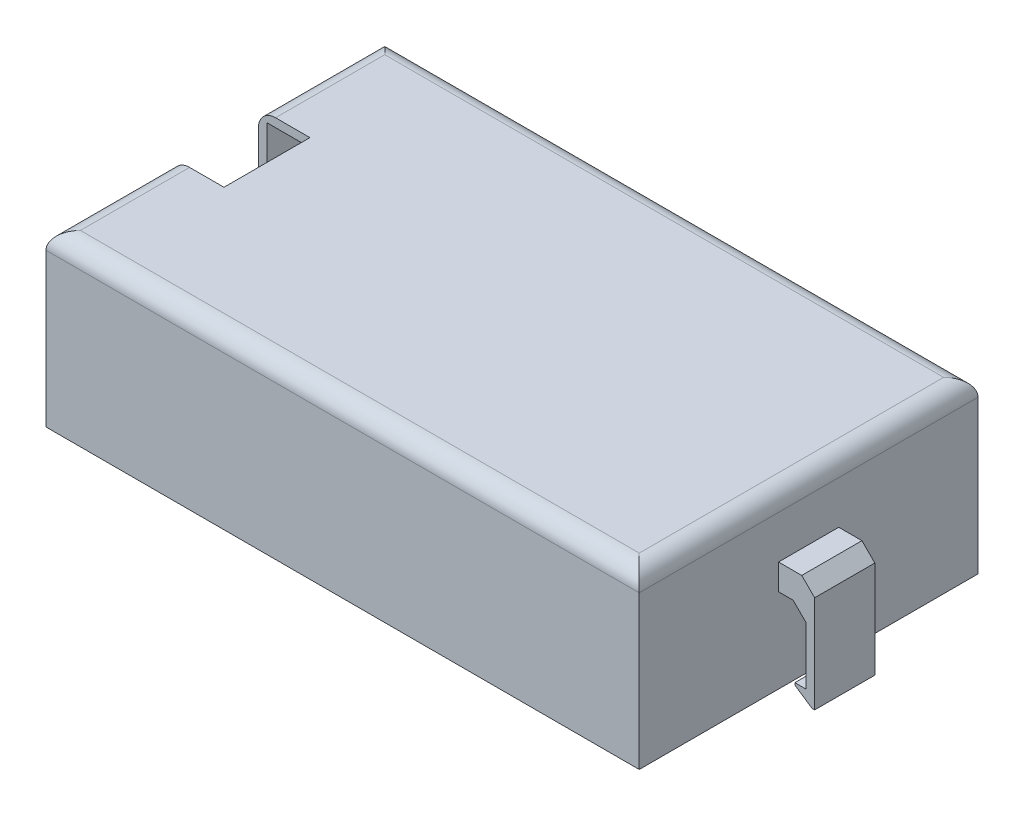
from build123d import *

# Parameters (mm, degrees)
EXTRUDE_THIN_START                    = 2
EXTRUDE_THIN_HOLDER_WALLS_OUTLINE_W   = 69
EXTRUDE_THIN_HOLDER_WALLS_OUTLINE_H   = 39.4
EXTRUDE_THIN_HOLDER_WALLS_OUTLINE_W_2 = 67
EXTRUDE_THIN_HOLDER_WALLS_OUTLINE_H_2 = 37.4
EXTRUDE_THIN_HOLDER_WALLS_DEPTH       = 19.8
BOSS_EXTRUDE_START                    = 20.8
BATTERY_HOLDER_AREA_8_W               = 28.6
BATTERY_HOLDER_AREA_8_H               = 37.4
BATTERY_HOLDER_AREA_8_W_2             = 5
BATTERY_HOLDER_AREA_8_H_2             = 10
BOSS_EXTRUDE_HOLDER_TOP_DEPTH         = 1
CUT_EXTRUDE_START                     = 14.8
BATTERY_HOLDER_AREA_6_W               = 1
BATTERY_HOLDER_AREA_6_H               = 10
BATTERY_HOLDER_AREA_6_W_2             = 5
CUT_EXTRUDE_BATTERY_CABLE_DEPTH       = 7
BOSS_EXTRUDE_START_2                  = 2
BOSS_EXTRUDE_SLIDE_CLAMP_DEPTH        = 1.5
FILLET_SLIDE_CLAMP_SIZE               = 0.75
FILLET_HOLDER_EDGES_R                 = 2
BATTERY_HOLDER_AREA_6_2_W             = 1
BATTERY_HOLDER_AREA_6_2_H             = 7
EXTRUDE_THIN_HOLDER_CLIPS_DEPTH       = 12.8
BOSS_EXTRUDE_START_3                  = 14.8
BATTERY_HOLDER_AREA_6_3_W             = 3
BATTERY_HOLDER_AREA_6_3_H             = 7
BATTERY_HOLDER_AREA_6_3_W_2           = 1.2
BOSS_EXTRUDE_HOLDER_CLIP_BASES_DEPTH  = 3
CHAMFER_HOLDER_CLIP_BASES_SIZE        = 1.5
BATTERY_HOLDER_AREA_6_4_W             = 2.3
BATTERY_HOLDER_AREA_6_4_H             = 7
EXTRUDE_THIN_HOLDER_CLIP_HOOK_DEPTH   = 1.6
CHAMFER_HOLDER_CLIP_HOOK_SIZE         = 1.349017034
CHAMFER_HOLDER_CLIP_HOOK_SIZE2        = 2


with BuildPart() as part:
    # Extrude-Thin holder walls: read off the stored shape, not the designer's step
    # Extrude-Thin holder walls outline → Extrude-Thin holder walls (new body)
    with BuildSketch(Plane(origin=(0, 0, 0), x_dir=(1, 0, 0), z_dir=(0, 1, 0)).offset(EXTRUDE_THIN_START)):
        with Locations((0, -11.3)):
            Rectangle(EXTRUDE_THIN_HOLDER_WALLS_OUTLINE_W, EXTRUDE_THIN_HOLDER_WALLS_OUTLINE_H)
        with Locations((0, -11.3)):
            Rectangle(EXTRUDE_THIN_HOLDER_WALLS_OUTLINE_W_2, EXTRUDE_THIN_HOLDER_WALLS_OUTLINE_H_2, mode=Mode.SUBTRACT)
    extrude(amount=EXTRUDE_THIN_HOLDER_WALLS_DEPTH)

    # Battery holder area_8 → Boss-Extrude holder top (add)
    with BuildSketch(Plane(origin=(0, 0, 0), x_dir=(1, 0, 0), z_dir=(0, 1, 0)).offset(BOSS_EXTRUDE_START)):
        Polygon((0, -30), (0, 7.4), (-33.5, 7.4), (-33.5, 6.1), (-33.5, -6.3), (-28.5, -6.3), (-28.5, -16.3), (-33.5, -16.3), (-33.5, -28.7), (-33.5, -30), align=None)
        with Locations((14.3, -11.3)):
            Rectangle(BATTERY_HOLDER_AREA_8_W, BATTERY_HOLDER_AREA_8_H)
        Polygon((33.5, 7.4), (28.6, 7.4), (28.6, -30), (33.5, -30), (33.5, -14.8), (33.5, -7.8), align=None)
        with Locations((-31, -11.3)):
            Rectangle(BATTERY_HOLDER_AREA_8_W_2, BATTERY_HOLDER_AREA_8_H_2)
    extrude(amount=BOSS_EXTRUDE_HOLDER_TOP_DEPTH)

    # Battery holder area_6 → Cut-Extrude battery cable (cut)
    with BuildSketch(Plane(origin=(0, 0, 0), x_dir=(1, 0, 0), z_dir=(0, 1, 0)).offset(CUT_EXTRUDE_START)):
        with Locations((-34, -11.3)):
            Rectangle(BATTERY_HOLDER_AREA_6_W, BATTERY_HOLDER_AREA_6_H)
        with Locations((-31, -11.3)):
            Rectangle(BATTERY_HOLDER_AREA_6_W_2, BATTERY_HOLDER_AREA_6_H)
    extrude(amount=CUT_EXTRUDE_BATTERY_CABLE_DEPTH, mode=Mode.SUBTRACT)

    # Battery holder area_8 2 → Boss-Extrude slide clamp (add)
    with BuildSketch(Plane(origin=(0, 0, 0), x_dir=(1, 0, 0), z_dir=(0, 1, 0)).offset(BOSS_EXTRUDE_START_2)):
        Polygon((-36.5, -28.7), (-33.5, -28.7), (-33.5, -16.3), (-34.5, -16.3), (-34.5, -6.3), (-33.5, -6.3), (-33.5, 6.1), (-36.5, 6.1), align=None)
    extrude(amount=BOSS_EXTRUDE_SLIDE_CLAMP_DEPTH)

    # Fillet slide clamp
    # a fillet whose section is not a circle: 0.75 mm, written as the material it takes off along each edge
    with BuildSketch(Plane(origin=(-36.5, 2, -7.975), x_dir=(0, 1, 0), z_dir=(0, 0, 1))) as fillet_slide_clamp_piece_1:
        with BuildLine():
            add(Edge.make_bspline([(FILLET_SLIDE_CLAMP_SIZE, 0), (FILLET_SLIDE_CLAMP_SIZE * 0.831801948466, 0), (FILLET_SLIDE_CLAMP_SIZE * 0.663603896932, 0), (FILLET_SLIDE_CLAMP_SIZE * 0.292893218813, -FILLET_SLIDE_CLAMP_SIZE * 0.0716919198361), (FILLET_SLIDE_CLAMP_SIZE * 0.0716919198361, -FILLET_SLIDE_CLAMP_SIZE * 0.292893218813), (0, -FILLET_SLIDE_CLAMP_SIZE * 0.663603896932), (0, -FILLET_SLIDE_CLAMP_SIZE * 0.831801948466), (0, -FILLET_SLIDE_CLAMP_SIZE)], knots=[0, 0, 0, 0, 0, 0, 0.5, 0.5, 1, 1, 1, 1, 1, 1], degree=5))
            Line((0, -FILLET_SLIDE_CLAMP_SIZE), (0, 0))
            Line((0, 0), (FILLET_SLIDE_CLAMP_SIZE, 0))
        make_face()
    extrude(amount=38.55, mode=Mode.SUBTRACT)

    # Fillet holder edges
    fillet_holder_edges_edges = [part.edges().sort_by_distance(p)[0] for p in [
        (34.5, 21.8, 11.3),
        (0, 21.8, 31),
        (-34.5, 21.8, 23.65),
        (0, 21.8, -8.4),
        (-34.5, 21.8, -1.05),
    ]]
    fillet(fillet_holder_edges_edges, radius=FILLET_HOLDER_EDGES_R)



with BuildPart() as body_2:
    # Battery holder area_6 2 → Extrude-Thin holder clips (new body)
    with BuildSketch(Plane(origin=(0, 0, 0), x_dir=(1, 0, 0), z_dir=(0, 1, 0)).offset(EXTRUDE_THIN_START)):
        with Locations((38.2, -11.3)):
            Rectangle(BATTERY_HOLDER_AREA_6_2_W, BATTERY_HOLDER_AREA_6_2_H)
    extrude(amount=EXTRUDE_THIN_HOLDER_CLIPS_DEPTH)


with BuildPart() as part_1:
    add(part.part)

    add(body_2.part)  # Boss-Extrude holder clip bases merges body 2
    # Battery holder area_6 3 → Boss-Extrude holder clip bases (add)
    with BuildSketch(Plane(origin=(0, 0, 0), x_dir=(1, 0, 0), z_dir=(0, 1, 0)).offset(BOSS_EXTRUDE_START_3)):
        with Locations((36.2, -11.3)):
            Rectangle(BATTERY_HOLDER_AREA_6_3_W, BATTERY_HOLDER_AREA_6_3_H)
        with Locations((34.1, -11.3)):
            Rectangle(BATTERY_HOLDER_AREA_6_3_W_2, BATTERY_HOLDER_AREA_6_3_H)
    extrude(amount=-BOSS_EXTRUDE_HOLDER_CLIP_BASES_DEPTH)

    # Chamfer holder clip bases
    chamfer_holder_clip_bases_edges = [part_1.edges().sort_by_distance(p)[0] for p in [
        (37.7, 11.8, 11.3),
        (38.7, 14.8, 11.3),
    ]]
    chamfer(chamfer_holder_clip_bases_edges, length=CHAMFER_HOLDER_CLIP_BASES_SIZE)

    # Battery holder area_6 4 → Extrude-Thin holder clip hook (add)
    with BuildSketch(Plane(origin=(0, 0, 0), x_dir=(1, 0, 0), z_dir=(0, 1, 0)).offset(EXTRUDE_THIN_START)):
        with Locations((37.55, -11.3)):
            Rectangle(BATTERY_HOLDER_AREA_6_4_W, BATTERY_HOLDER_AREA_6_4_H)
    extrude(amount=EXTRUDE_THIN_HOLDER_CLIP_HOOK_DEPTH)

    # Chamfer holder clip hook
    chamfer_holder_clip_hook_edges = [part_1.edges().sort_by_distance(p)[0] for p in [
        (36.4, 2, 11.3),
    ]]
    chamfer_holder_clip_hook_side = [part_1.faces().sort_by_distance(p)[0] for p in [
        (36.4, 2.8, 11.3),
    ]]
    chamfer(chamfer_holder_clip_hook_edges, length=CHAMFER_HOLDER_CLIP_HOOK_SIZE, length2=CHAMFER_HOLDER_CLIP_HOOK_SIZE2, reference=chamfer_holder_clip_hook_side[0])


solid = part_1.part
